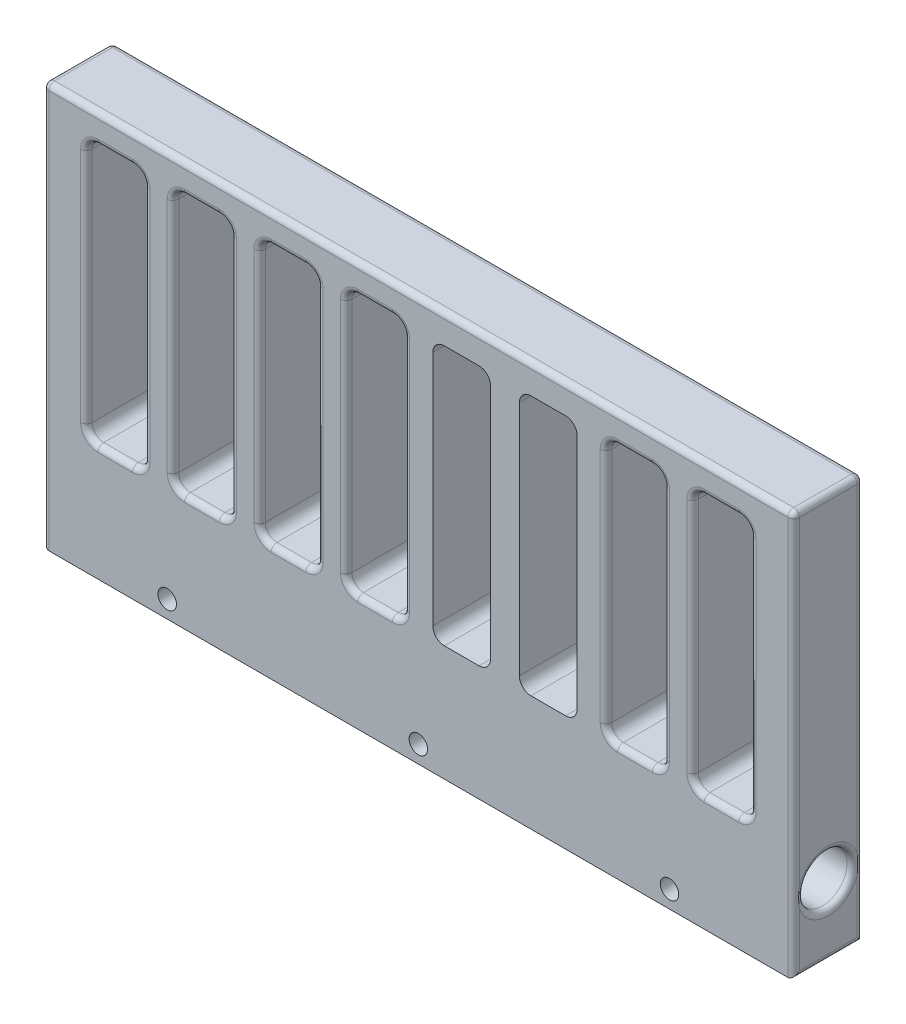
from build123d import *

# Parameters (mm, degrees)
ESQUISSE1_W             = 130
ESQUISSE1_H             = 70
BOSS_EXTRU_1_DEPTH      = 12
ESQUISSE2_W             = 10
ESQUISSE2_H             = 45
ENL_V_MAT_EXTRU_2_DEPTH = 12
ESQUISSE3_R             = 4.25
ENL_V_MAT_EXTRU_3_DEPTH = 154
ESQUISSE4_R             = 1.6
ENL_V_MAT_EXTRU_4_DEPTH = 16
ENL_V_MAT_EXTRU_5_DEPTH = 3
CONG_1_R                = 2
CONG_2_R                = 1


with BuildPart() as part:
    # Esquisse1 → Boss.-Extru.1 (new body)
    with BuildSketch(Plane.XY):
        with Locations((65, 35)):
            Rectangle(ESQUISSE1_W, ESQUISSE1_H)
    extrude(amount=BOSS_EXTRU_1_DEPTH)

    # Esquisse2 → Enlèv. mat.-Extru.2 (cut)
    with BuildSketch(Plane.XY.offset(12)):
        with Locations((12.5, 42.5)):
            Rectangle(ESQUISSE2_W, ESQUISSE2_H)
        with Locations((27.5, 42.5)):
            Rectangle(ESQUISSE2_W, ESQUISSE2_H)
        with Locations((42.5, 42.5)):
            Rectangle(ESQUISSE2_W, ESQUISSE2_H)
        with Locations((57.5, 42.5)):
            Rectangle(ESQUISSE2_W, ESQUISSE2_H)
        with Locations((72.5, 42.5)):
            Rectangle(ESQUISSE2_W, ESQUISSE2_H)
        with Locations((87.5, 42.5)):
            Rectangle(ESQUISSE2_W, ESQUISSE2_H)
        with Locations((102.5, 42.5)):
            Rectangle(ESQUISSE2_W, ESQUISSE2_H)
        with Locations((117.5, 42.5)):
            Rectangle(ESQUISSE2_W, ESQUISSE2_H)
    extrude(amount=-ENL_V_MAT_EXTRU_2_DEPTH, mode=Mode.SUBTRACT)

    # Esquisse3 → Enlèv. mat.-Extru.3 (cut)
    with BuildSketch(Plane.ZY):
        with Locations((6, 12)):
            Circle(ESQUISSE3_R)
    extrude(amount=-ENL_V_MAT_EXTRU_3_DEPTH, mode=Mode.SUBTRACT)

    # Esquisse4 → Enlèv. mat.-Extru.4 (cut)
    with BuildSketch(Plane.XY.offset(12)):
        with Locations((21.5, 3)):
            Circle(ESQUISSE4_R)
        with Locations((65, 3)):
            Circle(ESQUISSE4_R)
        with Locations((108.5, 3)):
            Circle(ESQUISSE4_R)
    extrude(amount=-ENL_V_MAT_EXTRU_4_DEPTH, mode=Mode.SUBTRACT)

    # Esquisse6 → Enlèv. mat.-Extru.5 (cut)
    with BuildSketch(Plane(origin=(0, 0, 0), x_dir=(-1, 0, 0), z_dir=(0, 0, -1))):
        Polygon((-20.163436833, 5.623661354), (-23.1038758, 5.469328333), (-24.440438967, 2.845666979), (-22.836563167, 0.376338646), (-19.8961242, 0.530671667), (-18.559561033, 3.154333021), align=None)
        Polygon((-62.462780767, 4.494161491), (-65.025372192, 5.944377057), (-67.562591426, 4.450215565), (-67.537219233, 1.505838509), (-64.974627808, 0.055622943), (-62.437408574, 1.549784435), align=None)
        Polygon((-106.006326077, 4.565755525), (-108.609147099, 5.942462729), (-111.102821022, 4.376707204), (-110.993673923, 1.434244475), (-108.390852901, 0.057537271), (-105.897178978, 1.623292796), align=None)
    extrude(amount=-ENL_V_MAT_EXTRU_5_DEPTH, mode=Mode.SUBTRACT)

    # Congé1
    cong_1_edges = [part.edges().sort_by_distance(p)[0] for p in [
        (7.5, 20, 6),
        (7.5, 65, 6),
        (17.5, 65, 6),
        (17.5, 20, 6),
        (32.5, 20, 6),
        (22.5, 20, 6),
        (22.5, 65, 6),
        (32.5, 65, 6),
        (47.5, 20, 6),
        (37.5, 20, 6),
        (37.5, 65, 6),
        (47.5, 65, 6),
        (62.5, 20, 6),
        (52.5, 20, 6),
        (52.5, 65, 6),
        (62.5, 65, 6),
        (77.5, 20, 6),
        (67.5, 20, 6),
        (67.5, 65, 6),
        (77.5, 65, 6),
        (92.5, 20, 6),
        (82.5, 20, 6),
        (82.5, 65, 6),
        (92.5, 65, 6),
        (107.5, 20, 6),
        (97.5, 20, 6),
        (97.5, 65, 6),
        (107.5, 65, 6),
        (122.5, 20, 6),
        (112.5, 20, 6),
        (112.5, 65, 6),
        (122.5, 65, 6),
    ]]
    fillet(cong_1_edges, radius=CONG_1_R)

    # Congé2
    # the kernel refuses this fillet: 1 mm, written as the material it takes off along each edge
    with BuildSketch(Plane(origin=(129, 69, 11), x_dir=(0, 1, 0), z_dir=(1, 0, 0))) as cong_2_piece_1_section:
        Polygon((0, 0), (CONG_2_R, 0), (CONG_2_R, CONG_2_R), (0, CONG_2_R), align=None)
    cong_2_piece_1 = extrude(amount=CONG_2_R, mode=Mode.PRIVATE)
    cong_2_piece_1 = cong_2_piece_1 - Plane(origin=(129, 69, 11), x_dir=(0, -0.7071067811865475, -0.7071067811865475), z_dir=(1, 0, 0)) * Sphere(CONG_2_R, mode=Mode.PRIVATE)
    add(cong_2_piece_1, mode=Mode.SUBTRACT)
    with BuildSketch(Plane(origin=(1, 69, 11), x_dir=(0, 1, 0), z_dir=(-1, 0, 0))) as cong_2_piece_2_section:
        Polygon((0, 0), (CONG_2_R, 0), (CONG_2_R, -CONG_2_R), (0, -CONG_2_R), align=None)
    cong_2_piece_2 = extrude(amount=CONG_2_R, mode=Mode.PRIVATE)
    cong_2_piece_2 = cong_2_piece_2 - Plane(origin=(1, 69, 11), x_dir=(0, -0.7071067811865475, -0.7071067811865475), z_dir=(-1, 0, 0)) * Sphere(CONG_2_R, mode=Mode.PRIVATE)
    add(cong_2_piece_2, mode=Mode.SUBTRACT)
    with BuildSketch(Plane(origin=(129, 69, 1), x_dir=(1, 0, 0), z_dir=(0, 0, -1))) as cong_2_piece_3_section:
        Polygon((0, 0), (CONG_2_R, 0), (CONG_2_R, -CONG_2_R), (0, -CONG_2_R), align=None)
    cong_2_piece_3 = extrude(amount=CONG_2_R, mode=Mode.PRIVATE)
    cong_2_piece_3 = cong_2_piece_3 - Plane(origin=(129, 69, 1), x_dir=(-0.7071067811865475, -0.7071067811865475, 0), z_dir=(0, 0, -1)) * Sphere(CONG_2_R, mode=Mode.PRIVATE)
    add(cong_2_piece_3, mode=Mode.SUBTRACT)
    with BuildSketch(Plane(origin=(1, 69, 1), x_dir=(-1, 0, 0), z_dir=(0, 0, -1))) as cong_2_piece_4_section:
        Polygon((0, 0), (CONG_2_R, 0), (CONG_2_R, CONG_2_R), (0, CONG_2_R), align=None)
    cong_2_piece_4 = extrude(amount=CONG_2_R, mode=Mode.PRIVATE)
    cong_2_piece_4 = cong_2_piece_4 - Plane(origin=(1, 69, 1), x_dir=(0.7071067811865475, -0.7071067811865475, 0), z_dir=(0, 0, -1)) * Sphere(CONG_2_R, mode=Mode.PRIVATE)
    add(cong_2_piece_4, mode=Mode.SUBTRACT)
    with BuildSketch(Plane(origin=(130, -2.5, 12), x_dir=(0, 0, -1), z_dir=(0, 1, 0)), Plane(origin=(0, 69, 12), x_dir=(0, 0, -1), z_dir=(0, -1, 0)), Plane(origin=(130, -2.5, 0), x_dir=(-1, 0, 0), z_dir=(0, 1, 0)), Plane(origin=(0, 69, 0), x_dir=(1, 0, 0), z_dir=(0, -1, 0))) as cong_2_piece_5:
        with BuildLine():
            CenterArc((CONG_2_R, CONG_2_R), CONG_2_R, 180, 90)
            Line((0, CONG_2_R), (0, 0))
            Line((0, 0), (CONG_2_R, 0))
        make_face()
    extrude(amount=71.5, mode=Mode.SUBTRACT)
    with BuildSketch(Plane(origin=(129, 70, 12), x_dir=(0, 0, -1), z_dir=(-1, 0, 0)), Plane(origin=(129, 70, 0), x_dir=(0, -1, 0), z_dir=(-1, 0, 0))) as cong_2_piece_6:
        with BuildLine():
            CenterArc((CONG_2_R, CONG_2_R), CONG_2_R, 180, 90)
            Line((0, CONG_2_R), (0, 0))
            Line((0, 0), (CONG_2_R, 0))
        make_face()
    extrude(amount=128, mode=Mode.SUBTRACT)
    with BuildSketch(Plane(origin=(130, 12, 6), x_dir=(0, 0, 1), z_dir=(0, -1, 0))) as cong_2_piece_7:
        with BuildLine():
            CenterArc((4.25 + CONG_2_R, CONG_2_R), CONG_2_R, 180, 90)
            Line((4.25, CONG_2_R), (4.25, 0))
            Line((4.25, 0), (4.25 + CONG_2_R, 0))
        make_face()
    revolve(axis=Axis((130, 12, 6), (-1, 0, 0)), mode=Mode.SUBTRACT)
    with BuildSketch(Plane(origin=(0, 12, 6), x_dir=(0, 0, 1), z_dir=(0, -1, 0))) as cong_2_piece_8:
        with BuildLine():
            CenterArc((4.25 + CONG_2_R, -CONG_2_R), CONG_2_R, 90, 90)
            Line((4.25, -CONG_2_R), (4.25, 0))
            Line((4.25, 0), (4.25 + CONG_2_R, 0))
        make_face()
    revolve(axis=Axis((0, 12, 6), (-1, 0, 0)), mode=Mode.SUBTRACT)
    with BuildSketch(Plane(origin=(75.5, 20, 0), x_dir=(0, -1, 0), z_dir=(-1, 0, 0)), Plane(origin=(60.5, 20, 12), x_dir=(0, 0, -1), z_dir=(-1, 0, 0)), Plane(origin=(60.5, 20, 0), x_dir=(0, -1, 0), z_dir=(-1, 0, 0)), Plane(origin=(45.5, 20, 12), x_dir=(0, 0, -1), z_dir=(-1, 0, 0)), Plane(origin=(45.5, 20, 0), x_dir=(0, -1, 0), z_dir=(-1, 0, 0)), Plane(origin=(30.5, 20, 12), x_dir=(0, 0, -1), z_dir=(-1, 0, 0)), Plane(origin=(30.5, 20, 0), x_dir=(0, -1, 0), z_dir=(-1, 0, 0)), Plane(origin=(105.5, 20, 12), x_dir=(0, 0, -1), z_dir=(-1, 0, 0)), Plane(origin=(105.5, 20, 0), x_dir=(0, -1, 0), z_dir=(-1, 0, 0)), Plane(origin=(24.5, 65, 12), x_dir=(0, 0, -1), z_dir=(1, 0, 0)), Plane(origin=(24.5, 65, 0), x_dir=(0, 1, 0), z_dir=(1, 0, 0)), Plane(origin=(39.5, 65, 12), x_dir=(0, 0, -1), z_dir=(1, 0, 0)), Plane(origin=(39.5, 65, 0), x_dir=(0, 1, 0), z_dir=(1, 0, 0)), Plane(origin=(54.5, 65, 12), x_dir=(0, 0, -1), z_dir=(1, 0, 0)), Plane(origin=(54.5, 65, 0), x_dir=(0, 1, 0), z_dir=(1, 0, 0)), Plane(origin=(69.5, 65, 0), x_dir=(0, 1, 0), z_dir=(1, 0, 0)), Plane(origin=(99.5, 65, 12), x_dir=(0, 0, -1), z_dir=(1, 0, 0)), Plane(origin=(99.5, 65, 0), x_dir=(0, 1, 0), z_dir=(1, 0, 0)), Plane(origin=(114.5, 65, 12), x_dir=(0, 0, -1), z_dir=(1, 0, 0)), Plane(origin=(114.5, 65, 0), x_dir=(0, 1, 0), z_dir=(1, 0, 0)), Plane(origin=(120.5, 20, 12), x_dir=(0, 0, -1), z_dir=(-1, 0, 0)), Plane(origin=(120.5, 20, 0), x_dir=(0, -1, 0), z_dir=(-1, 0, 0))) as cong_2_piece_9:
        with BuildLine():
            CenterArc((CONG_2_R, CONG_2_R), CONG_2_R, 180, 90)
            Line((0, CONG_2_R), (0, 0))
            Line((0, 0), (CONG_2_R, 0))
        make_face()
    extrude(amount=6, mode=Mode.SUBTRACT)
    with BuildSketch(Plane(origin=(67.5, 22, 0), x_dir=(-1, 0, 0), z_dir=(0, 1, 0)), Plane(origin=(52.5, 22, 12), x_dir=(0, 0, -1), z_dir=(0, 1, 0)), Plane(origin=(52.5, 22, 0), x_dir=(-1, 0, 0), z_dir=(0, 1, 0)), Plane(origin=(37.5, 22, 12), x_dir=(0, 0, -1), z_dir=(0, 1, 0)), Plane(origin=(37.5, 22, 0), x_dir=(-1, 0, 0), z_dir=(0, 1, 0)), Plane(origin=(22.5, 22, 12), x_dir=(0, 0, -1), z_dir=(0, 1, 0)), Plane(origin=(22.5, 22, 0), x_dir=(-1, 0, 0), z_dir=(0, 1, 0)), Plane(origin=(97.5, 22, 12), x_dir=(0, 0, -1), z_dir=(0, 1, 0)), Plane(origin=(97.5, 22, 0), x_dir=(-1, 0, 0), z_dir=(0, 1, 0)), Plane(origin=(112.5, 22, 12), x_dir=(0, 0, -1), z_dir=(0, 1, 0)), Plane(origin=(112.5, 22, 0), x_dir=(-1, 0, 0), z_dir=(0, 1, 0)), Plane(origin=(122.5, 63, 12), x_dir=(0, 0, -1), z_dir=(0, -1, 0)), Plane(origin=(122.5, 63, 0), x_dir=(1, 0, 0), z_dir=(0, -1, 0)), Plane(origin=(107.5, 63, 12), x_dir=(0, 0, -1), z_dir=(0, -1, 0)), Plane(origin=(107.5, 63, 0), x_dir=(1, 0, 0), z_dir=(0, -1, 0)), Plane(origin=(77.5, 63, 0), x_dir=(1, 0, 0), z_dir=(0, -1, 0)), Plane(origin=(62.5, 63, 12), x_dir=(0, 0, -1), z_dir=(0, -1, 0)), Plane(origin=(62.5, 63, 0), x_dir=(1, 0, 0), z_dir=(0, -1, 0)), Plane(origin=(47.5, 63, 12), x_dir=(0, 0, -1), z_dir=(0, -1, 0)), Plane(origin=(47.5, 63, 0), x_dir=(1, 0, 0), z_dir=(0, -1, 0)), Plane(origin=(32.5, 63, 12), x_dir=(0, 0, -1), z_dir=(0, -1, 0)), Plane(origin=(32.5, 63, 0), x_dir=(1, 0, 0), z_dir=(0, -1, 0))) as cong_2_piece_10:
        with BuildLine():
            CenterArc((CONG_2_R, CONG_2_R), CONG_2_R, 180, 90)
            Line((0, CONG_2_R), (0, 0))
            Line((0, 0), (CONG_2_R, 0))
        make_face()
    extrude(amount=41, mode=Mode.SUBTRACT)
    with BuildSketch(Plane(origin=(9.5, 20, 12), x_dir=(0, 0, -1), z_dir=(1, 0, 0)), Plane(origin=(9.5, 20, 0), x_dir=(0, -1, 0), z_dir=(1, 0, 0)), Plane(origin=(15.5, 65, 12), x_dir=(0, 0, -1), z_dir=(-1, 0, 0)), Plane(origin=(15.5, 65, 0), x_dir=(0, 1, 0), z_dir=(-1, 0, 0))) as cong_2_piece_11:
        with BuildLine():
            CenterArc((CONG_2_R, -CONG_2_R), CONG_2_R, 90, 90)
            Line((0, -CONG_2_R), (0, 0))
            Line((0, 0), (CONG_2_R, 0))
        make_face()
    extrude(amount=6, mode=Mode.SUBTRACT)
    with BuildSketch(Plane(origin=(7.5, 63, 12), x_dir=(0, 0, -1), z_dir=(0, -1, 0)), Plane(origin=(7.5, 63, 0), x_dir=(-1, 0, 0), z_dir=(0, -1, 0)), Plane(origin=(17.5, 22, 12), x_dir=(0, 0, -1), z_dir=(0, 1, 0)), Plane(origin=(17.5, 22, 0), x_dir=(1, 0, 0), z_dir=(0, 1, 0))) as cong_2_piece_12:
        with BuildLine():
            CenterArc((CONG_2_R, -CONG_2_R), CONG_2_R, 90, 90)
            Line((0, -CONG_2_R), (0, 0))
            Line((0, 0), (CONG_2_R, 0))
        make_face()
    extrude(amount=41, mode=Mode.SUBTRACT)
    with BuildSketch(Plane(origin=(69.5, 22, 0), x_dir=(0, -1, 0), z_dir=(1, 0, 0))) as cong_2_piece_13:
        with BuildLine():
            CenterArc((2 + CONG_2_R, -CONG_2_R), CONG_2_R, 90, 90)
            Line((2, -CONG_2_R), (2, 0))
            Line((2, 0), (2 + CONG_2_R, 0))
        make_face()
    revolve(axis=Axis((69.5, 22, 0), (0, 0, -1)), revolution_arc=90, mode=Mode.SUBTRACT)
    with BuildSketch(Plane(origin=(54.5, 22, 12), x_dir=(0, -1, 0), z_dir=(1, 0, 0))) as cong_2_piece_14:
        with BuildLine():
            CenterArc((2 + CONG_2_R, CONG_2_R), CONG_2_R, 180, 90)
            Line((2 + CONG_2_R, 0), (2, 0))
            Line((2, 0), (2, CONG_2_R))
        make_face()
    revolve(axis=Axis((54.5, 22, 12), (0, 0, -1)), revolution_arc=90, mode=Mode.SUBTRACT)
    with BuildSketch(Plane(origin=(54.5, 22, 0), x_dir=(0, -1, 0), z_dir=(1, 0, 0))) as cong_2_piece_15:
        with BuildLine():
            CenterArc((2 + CONG_2_R, -CONG_2_R), CONG_2_R, 90, 90)
            Line((2, -CONG_2_R), (2, 0))
            Line((2, 0), (2 + CONG_2_R, 0))
        make_face()
    revolve(axis=Axis((54.5, 22, 0), (0, 0, -1)), revolution_arc=90, mode=Mode.SUBTRACT)
    with BuildSketch(Plane(origin=(39.5, 22, 12), x_dir=(0, -1, 0), z_dir=(1, 0, 0))) as cong_2_piece_16:
        with BuildLine():
            CenterArc((2 + CONG_2_R, CONG_2_R), CONG_2_R, 180, 90)
            Line((2 + CONG_2_R, 0), (2, 0))
            Line((2, 0), (2, CONG_2_R))
        make_face()
    revolve(axis=Axis((39.5, 22, 12), (0, 0, -1)), revolution_arc=90, mode=Mode.SUBTRACT)
    with BuildSketch(Plane(origin=(39.5, 22, 0), x_dir=(0, -1, 0), z_dir=(1, 0, 0))) as cong_2_piece_17:
        with BuildLine():
            CenterArc((2 + CONG_2_R, -CONG_2_R), CONG_2_R, 90, 90)
            Line((2, -CONG_2_R), (2, 0))
            Line((2, 0), (2 + CONG_2_R, 0))
        make_face()
    revolve(axis=Axis((39.5, 22, 0), (0, 0, -1)), revolution_arc=90, mode=Mode.SUBTRACT)
    with BuildSketch(Plane(origin=(24.5, 22, 12), x_dir=(0, -1, 0), z_dir=(1, 0, 0))) as cong_2_piece_18:
        with BuildLine():
            CenterArc((2 + CONG_2_R, CONG_2_R), CONG_2_R, 180, 90)
            Line((2 + CONG_2_R, 0), (2, 0))
            Line((2, 0), (2, CONG_2_R))
        make_face()
    revolve(axis=Axis((24.5, 22, 12), (0, 0, -1)), revolution_arc=90, mode=Mode.SUBTRACT)
    with BuildSketch(Plane(origin=(24.5, 22, 0), x_dir=(0, -1, 0), z_dir=(1, 0, 0))) as cong_2_piece_19:
        with BuildLine():
            CenterArc((2 + CONG_2_R, -CONG_2_R), CONG_2_R, 90, 90)
            Line((2, -CONG_2_R), (2, 0))
            Line((2, 0), (2 + CONG_2_R, 0))
        make_face()
    revolve(axis=Axis((24.5, 22, 0), (0, 0, -1)), revolution_arc=90, mode=Mode.SUBTRACT)
    with BuildSketch(Plane(origin=(9.5, 22, 12), x_dir=(0, -1, 0), z_dir=(1, 0, 0))) as cong_2_piece_20:
        with BuildLine():
            CenterArc((2 + CONG_2_R, CONG_2_R), CONG_2_R, 180, 90)
            Line((2 + CONG_2_R, 0), (2, 0))
            Line((2, 0), (2, CONG_2_R))
        make_face()
    revolve(axis=Axis((9.5, 22, 12), (0, 0, -1)), revolution_arc=90, mode=Mode.SUBTRACT)
    with BuildSketch(Plane(origin=(9.5, 22, 0), x_dir=(0, -1, 0), z_dir=(1, 0, 0))) as cong_2_piece_21:
        with BuildLine():
            CenterArc((2 + CONG_2_R, -CONG_2_R), CONG_2_R, 90, 90)
            Line((2, -CONG_2_R), (2, 0))
            Line((2, 0), (2 + CONG_2_R, 0))
        make_face()
    revolve(axis=Axis((9.5, 22, 0), (0, 0, -1)), revolution_arc=90, mode=Mode.SUBTRACT)
    with BuildSketch(Plane(origin=(99.5, 22, 12), x_dir=(0, -1, 0), z_dir=(1, 0, 0))) as cong_2_piece_22:
        with BuildLine():
            CenterArc((2 + CONG_2_R, CONG_2_R), CONG_2_R, 180, 90)
            Line((2 + CONG_2_R, 0), (2, 0))
            Line((2, 0), (2, CONG_2_R))
        make_face()
    revolve(axis=Axis((99.5, 22, 12), (0, 0, -1)), revolution_arc=90, mode=Mode.SUBTRACT)
    with BuildSketch(Plane(origin=(99.5, 22, 0), x_dir=(0, -1, 0), z_dir=(1, 0, 0))) as cong_2_piece_23:
        with BuildLine():
            CenterArc((2 + CONG_2_R, -CONG_2_R), CONG_2_R, 90, 90)
            Line((2, -CONG_2_R), (2, 0))
            Line((2, 0), (2 + CONG_2_R, 0))
        make_face()
    revolve(axis=Axis((99.5, 22, 0), (0, 0, -1)), revolution_arc=90, mode=Mode.SUBTRACT)
    with BuildSketch(Plane(origin=(9.5, 63, 12), x_dir=(-1, 0, 0), z_dir=(0, -1, 0))) as cong_2_piece_24:
        with BuildLine():
            CenterArc((2 + CONG_2_R, CONG_2_R), CONG_2_R, 180, 90)
            Line((2 + CONG_2_R, 0), (2, 0))
            Line((2, 0), (2, CONG_2_R))
        make_face()
    revolve(axis=Axis((9.5, 63, 12), (0, 0, -1)), revolution_arc=90, mode=Mode.SUBTRACT)
    with BuildSketch(Plane(origin=(9.5, 63, 0), x_dir=(-1, 0, 0), z_dir=(0, -1, 0))) as cong_2_piece_25:
        with BuildLine():
            CenterArc((2 + CONG_2_R, -CONG_2_R), CONG_2_R, 90, 90)
            Line((2, -CONG_2_R), (2, 0))
            Line((2, 0), (2 + CONG_2_R, 0))
        make_face()
    revolve(axis=Axis((9.5, 63, 0), (0, 0, -1)), revolution_arc=90, mode=Mode.SUBTRACT)
    with BuildSketch(Plane(origin=(24.5, 63, 12), x_dir=(-1, 0, 0), z_dir=(0, -1, 0))) as cong_2_piece_26:
        with BuildLine():
            CenterArc((2 + CONG_2_R, CONG_2_R), CONG_2_R, 180, 90)
            Line((2 + CONG_2_R, 0), (2, 0))
            Line((2, 0), (2, CONG_2_R))
        make_face()
    revolve(axis=Axis((24.5, 63, 12), (0, 0, -1)), revolution_arc=90, mode=Mode.SUBTRACT)
    with BuildSketch(Plane(origin=(24.5, 63, 0), x_dir=(-1, 0, 0), z_dir=(0, -1, 0))) as cong_2_piece_27:
        with BuildLine():
            CenterArc((2 + CONG_2_R, -CONG_2_R), CONG_2_R, 90, 90)
            Line((2, -CONG_2_R), (2, 0))
            Line((2, 0), (2 + CONG_2_R, 0))
        make_face()
    revolve(axis=Axis((24.5, 63, 0), (0, 0, -1)), revolution_arc=90, mode=Mode.SUBTRACT)
    with BuildSketch(Plane(origin=(39.5, 63, 12), x_dir=(-1, 0, 0), z_dir=(0, -1, 0))) as cong_2_piece_28:
        with BuildLine():
            CenterArc((2 + CONG_2_R, CONG_2_R), CONG_2_R, 180, 90)
            Line((2 + CONG_2_R, 0), (2, 0))
            Line((2, 0), (2, CONG_2_R))
        make_face()
    revolve(axis=Axis((39.5, 63, 12), (0, 0, -1)), revolution_arc=90, mode=Mode.SUBTRACT)
    with BuildSketch(Plane(origin=(39.5, 63, 0), x_dir=(-1, 0, 0), z_dir=(0, -1, 0))) as cong_2_piece_29:
        with BuildLine():
            CenterArc((2 + CONG_2_R, -CONG_2_R), CONG_2_R, 90, 90)
            Line((2, -CONG_2_R), (2, 0))
            Line((2, 0), (2 + CONG_2_R, 0))
        make_face()
    revolve(axis=Axis((39.5, 63, 0), (0, 0, -1)), revolution_arc=90, mode=Mode.SUBTRACT)
    with BuildSketch(Plane(origin=(54.5, 63, 12), x_dir=(-1, 0, 0), z_dir=(0, -1, 0))) as cong_2_piece_30:
        with BuildLine():
            CenterArc((2 + CONG_2_R, CONG_2_R), CONG_2_R, 180, 90)
            Line((2 + CONG_2_R, 0), (2, 0))
            Line((2, 0), (2, CONG_2_R))
        make_face()
    revolve(axis=Axis((54.5, 63, 12), (0, 0, -1)), revolution_arc=90, mode=Mode.SUBTRACT)
    with BuildSketch(Plane(origin=(54.5, 63, 0), x_dir=(-1, 0, 0), z_dir=(0, -1, 0))) as cong_2_piece_31:
        with BuildLine():
            CenterArc((2 + CONG_2_R, -CONG_2_R), CONG_2_R, 90, 90)
            Line((2, -CONG_2_R), (2, 0))
            Line((2, 0), (2 + CONG_2_R, 0))
        make_face()
    revolve(axis=Axis((54.5, 63, 0), (0, 0, -1)), revolution_arc=90, mode=Mode.SUBTRACT)
    with BuildSketch(Plane(origin=(69.5, 63, 0), x_dir=(-1, 0, 0), z_dir=(0, -1, 0))) as cong_2_piece_32:
        with BuildLine():
            CenterArc((2 + CONG_2_R, -CONG_2_R), CONG_2_R, 90, 90)
            Line((2, -CONG_2_R), (2, 0))
            Line((2, 0), (2 + CONG_2_R, 0))
        make_face()
    revolve(axis=Axis((69.5, 63, 0), (0, 0, -1)), revolution_arc=90, mode=Mode.SUBTRACT)
    with BuildSketch(Plane(origin=(99.5, 63, 12), x_dir=(-1, 0, 0), z_dir=(0, -1, 0))) as cong_2_piece_33:
        with BuildLine():
            CenterArc((2 + CONG_2_R, CONG_2_R), CONG_2_R, 180, 90)
            Line((2 + CONG_2_R, 0), (2, 0))
            Line((2, 0), (2, CONG_2_R))
        make_face()
    revolve(axis=Axis((99.5, 63, 12), (0, 0, -1)), revolution_arc=90, mode=Mode.SUBTRACT)
    with BuildSketch(Plane(origin=(99.5, 63, 0), x_dir=(-1, 0, 0), z_dir=(0, -1, 0))) as cong_2_piece_34:
        with BuildLine():
            CenterArc((2 + CONG_2_R, -CONG_2_R), CONG_2_R, 90, 90)
            Line((2, -CONG_2_R), (2, 0))
            Line((2, 0), (2 + CONG_2_R, 0))
        make_face()
    revolve(axis=Axis((99.5, 63, 0), (0, 0, -1)), revolution_arc=90, mode=Mode.SUBTRACT)
    with BuildSketch(Plane(origin=(114.5, 63, 12), x_dir=(-1, 0, 0), z_dir=(0, -1, 0))) as cong_2_piece_35:
        with BuildLine():
            CenterArc((2 + CONG_2_R, CONG_2_R), CONG_2_R, 180, 90)
            Line((2 + CONG_2_R, 0), (2, 0))
            Line((2, 0), (2, CONG_2_R))
        make_face()
    revolve(axis=Axis((114.5, 63, 12), (0, 0, -1)), revolution_arc=90, mode=Mode.SUBTRACT)
    with BuildSketch(Plane(origin=(114.5, 63, 0), x_dir=(-1, 0, 0), z_dir=(0, -1, 0))) as cong_2_piece_36:
        with BuildLine():
            CenterArc((2 + CONG_2_R, -CONG_2_R), CONG_2_R, 90, 90)
            Line((2, -CONG_2_R), (2, 0))
            Line((2, 0), (2 + CONG_2_R, 0))
        make_face()
    revolve(axis=Axis((114.5, 63, 0), (0, 0, -1)), revolution_arc=90, mode=Mode.SUBTRACT)
    with BuildSketch(Plane(origin=(120.5, 63, 12), x_dir=(1, 0, 0), z_dir=(0, -1, 0))) as cong_2_piece_37:
        with BuildLine():
            CenterArc((2 + CONG_2_R, -CONG_2_R), CONG_2_R, 90, 90)
            Line((2 + CONG_2_R, 0), (2, 0))
            Line((2, 0), (2, -CONG_2_R))
        make_face()
    revolve(axis=Axis((120.5, 63, 12), (0, 0, 1)), revolution_arc=90, mode=Mode.SUBTRACT)
    with BuildSketch(Plane(origin=(120.5, 63, 0), x_dir=(1, 0, 0), z_dir=(0, -1, 0))) as cong_2_piece_38:
        with BuildLine():
            CenterArc((2 + CONG_2_R, CONG_2_R), CONG_2_R, 180, 90)
            Line((2, CONG_2_R), (2, 0))
            Line((2, 0), (2 + CONG_2_R, 0))
        make_face()
    revolve(axis=Axis((120.5, 63, 0), (0, 0, 1)), revolution_arc=90, mode=Mode.SUBTRACT)
    with BuildSketch(Plane(origin=(105.5, 63, 12), x_dir=(1, 0, 0), z_dir=(0, -1, 0))) as cong_2_piece_39:
        with BuildLine():
            CenterArc((2 + CONG_2_R, -CONG_2_R), CONG_2_R, 90, 90)
            Line((2 + CONG_2_R, 0), (2, 0))
            Line((2, 0), (2, -CONG_2_R))
        make_face()
    revolve(axis=Axis((105.5, 63, 12), (0, 0, 1)), revolution_arc=90, mode=Mode.SUBTRACT)
    with BuildSketch(Plane(origin=(105.5, 63, 0), x_dir=(1, 0, 0), z_dir=(0, -1, 0))) as cong_2_piece_40:
        with BuildLine():
            CenterArc((2 + CONG_2_R, CONG_2_R), CONG_2_R, 180, 90)
            Line((2, CONG_2_R), (2, 0))
            Line((2, 0), (2 + CONG_2_R, 0))
        make_face()
    revolve(axis=Axis((105.5, 63, 0), (0, 0, 1)), revolution_arc=90, mode=Mode.SUBTRACT)
    with BuildSketch(Plane(origin=(75.5, 63, 0), x_dir=(1, 0, 0), z_dir=(0, -1, 0))) as cong_2_piece_41:
        with BuildLine():
            CenterArc((2 + CONG_2_R, CONG_2_R), CONG_2_R, 180, 90)
            Line((2, CONG_2_R), (2, 0))
            Line((2, 0), (2 + CONG_2_R, 0))
        make_face()
    revolve(axis=Axis((75.5, 63, 0), (0, 0, 1)), revolution_arc=90, mode=Mode.SUBTRACT)
    with BuildSketch(Plane(origin=(60.5, 63, 12), x_dir=(1, 0, 0), z_dir=(0, -1, 0))) as cong_2_piece_42:
        with BuildLine():
            CenterArc((2 + CONG_2_R, -CONG_2_R), CONG_2_R, 90, 90)
            Line((2 + CONG_2_R, 0), (2, 0))
            Line((2, 0), (2, -CONG_2_R))
        make_face()
    revolve(axis=Axis((60.5, 63, 12), (0, 0, 1)), revolution_arc=90, mode=Mode.SUBTRACT)
    with BuildSketch(Plane(origin=(60.5, 63, 0), x_dir=(1, 0, 0), z_dir=(0, -1, 0))) as cong_2_piece_43:
        with BuildLine():
            CenterArc((2 + CONG_2_R, CONG_2_R), CONG_2_R, 180, 90)
            Line((2, CONG_2_R), (2, 0))
            Line((2, 0), (2 + CONG_2_R, 0))
        make_face()
    revolve(axis=Axis((60.5, 63, 0), (0, 0, 1)), revolution_arc=90, mode=Mode.SUBTRACT)
    with BuildSketch(Plane(origin=(45.5, 63, 12), x_dir=(1, 0, 0), z_dir=(0, -1, 0))) as cong_2_piece_44:
        with BuildLine():
            CenterArc((2 + CONG_2_R, -CONG_2_R), CONG_2_R, 90, 90)
            Line((2 + CONG_2_R, 0), (2, 0))
            Line((2, 0), (2, -CONG_2_R))
        make_face()
    revolve(axis=Axis((45.5, 63, 12), (0, 0, 1)), revolution_arc=90, mode=Mode.SUBTRACT)
    with BuildSketch(Plane(origin=(45.5, 63, 0), x_dir=(1, 0, 0), z_dir=(0, -1, 0))) as cong_2_piece_45:
        with BuildLine():
            CenterArc((2 + CONG_2_R, CONG_2_R), CONG_2_R, 180, 90)
            Line((2, CONG_2_R), (2, 0))
            Line((2, 0), (2 + CONG_2_R, 0))
        make_face()
    revolve(axis=Axis((45.5, 63, 0), (0, 0, 1)), revolution_arc=90, mode=Mode.SUBTRACT)
    with BuildSketch(Plane(origin=(30.5, 63, 12), x_dir=(1, 0, 0), z_dir=(0, -1, 0))) as cong_2_piece_46:
        with BuildLine():
            CenterArc((2 + CONG_2_R, -CONG_2_R), CONG_2_R, 90, 90)
            Line((2 + CONG_2_R, 0), (2, 0))
            Line((2, 0), (2, -CONG_2_R))
        make_face()
    revolve(axis=Axis((30.5, 63, 12), (0, 0, 1)), revolution_arc=90, mode=Mode.SUBTRACT)
    with BuildSketch(Plane(origin=(30.5, 63, 0), x_dir=(1, 0, 0), z_dir=(0, -1, 0))) as cong_2_piece_47:
        with BuildLine():
            CenterArc((2 + CONG_2_R, CONG_2_R), CONG_2_R, 180, 90)
            Line((2, CONG_2_R), (2, 0))
            Line((2, 0), (2 + CONG_2_R, 0))
        make_face()
    revolve(axis=Axis((30.5, 63, 0), (0, 0, 1)), revolution_arc=90, mode=Mode.SUBTRACT)
    with BuildSketch(Plane(origin=(15.5, 63, 12), x_dir=(1, 0, 0), z_dir=(0, -1, 0))) as cong_2_piece_48:
        with BuildLine():
            CenterArc((2 + CONG_2_R, -CONG_2_R), CONG_2_R, 90, 90)
            Line((2 + CONG_2_R, 0), (2, 0))
            Line((2, 0), (2, -CONG_2_R))
        make_face()
    revolve(axis=Axis((15.5, 63, 12), (0, 0, 1)), revolution_arc=90, mode=Mode.SUBTRACT)
    with BuildSketch(Plane(origin=(15.5, 63, 0), x_dir=(1, 0, 0), z_dir=(0, -1, 0))) as cong_2_piece_49:
        with BuildLine():
            CenterArc((2 + CONG_2_R, CONG_2_R), CONG_2_R, 180, 90)
            Line((2, CONG_2_R), (2, 0))
            Line((2, 0), (2 + CONG_2_R, 0))
        make_face()
    revolve(axis=Axis((15.5, 63, 0), (0, 0, 1)), revolution_arc=90, mode=Mode.SUBTRACT)
    with BuildSketch(Plane(origin=(15.5, 22, 12), x_dir=(0, -1, 0), z_dir=(-1, 0, 0))) as cong_2_piece_50:
        with BuildLine():
            CenterArc((2 + CONG_2_R, -CONG_2_R), CONG_2_R, 90, 90)
            Line((2 + CONG_2_R, 0), (2, 0))
            Line((2, 0), (2, -CONG_2_R))
        make_face()
    revolve(axis=Axis((15.5, 22, 12), (0, 0, 1)), revolution_arc=90, mode=Mode.SUBTRACT)
    with BuildSketch(Plane(origin=(15.5, 22, 0), x_dir=(0, -1, 0), z_dir=(-1, 0, 0))) as cong_2_piece_51:
        with BuildLine():
            CenterArc((2 + CONG_2_R, CONG_2_R), CONG_2_R, 180, 90)
            Line((2, CONG_2_R), (2, 0))
            Line((2, 0), (2 + CONG_2_R, 0))
        make_face()
    revolve(axis=Axis((15.5, 22, 0), (0, 0, 1)), revolution_arc=90, mode=Mode.SUBTRACT)
    with BuildSketch(Plane(origin=(30.5, 22, 12), x_dir=(0, -1, 0), z_dir=(-1, 0, 0))) as cong_2_piece_52:
        with BuildLine():
            CenterArc((2 + CONG_2_R, -CONG_2_R), CONG_2_R, 90, 90)
            Line((2 + CONG_2_R, 0), (2, 0))
            Line((2, 0), (2, -CONG_2_R))
        make_face()
    revolve(axis=Axis((30.5, 22, 12), (0, 0, 1)), revolution_arc=90, mode=Mode.SUBTRACT)
    with BuildSketch(Plane(origin=(30.5, 22, 0), x_dir=(0, -1, 0), z_dir=(-1, 0, 0))) as cong_2_piece_53:
        with BuildLine():
            CenterArc((2 + CONG_2_R, CONG_2_R), CONG_2_R, 180, 90)
            Line((2, CONG_2_R), (2, 0))
            Line((2, 0), (2 + CONG_2_R, 0))
        make_face()
    revolve(axis=Axis((30.5, 22, 0), (0, 0, 1)), revolution_arc=90, mode=Mode.SUBTRACT)
    with BuildSketch(Plane(origin=(45.5, 22, 12), x_dir=(0, -1, 0), z_dir=(-1, 0, 0))) as cong_2_piece_54:
        with BuildLine():
            CenterArc((2 + CONG_2_R, -CONG_2_R), CONG_2_R, 90, 90)
            Line((2 + CONG_2_R, 0), (2, 0))
            Line((2, 0), (2, -CONG_2_R))
        make_face()
    revolve(axis=Axis((45.5, 22, 12), (0, 0, 1)), revolution_arc=90, mode=Mode.SUBTRACT)
    with BuildSketch(Plane(origin=(45.5, 22, 0), x_dir=(0, -1, 0), z_dir=(-1, 0, 0))) as cong_2_piece_55:
        with BuildLine():
            CenterArc((2 + CONG_2_R, CONG_2_R), CONG_2_R, 180, 90)
            Line((2, CONG_2_R), (2, 0))
            Line((2, 0), (2 + CONG_2_R, 0))
        make_face()
    revolve(axis=Axis((45.5, 22, 0), (0, 0, 1)), revolution_arc=90, mode=Mode.SUBTRACT)
    with BuildSketch(Plane(origin=(60.5, 22, 12), x_dir=(0, -1, 0), z_dir=(-1, 0, 0))) as cong_2_piece_56:
        with BuildLine():
            CenterArc((2 + CONG_2_R, -CONG_2_R), CONG_2_R, 90, 90)
            Line((2 + CONG_2_R, 0), (2, 0))
            Line((2, 0), (2, -CONG_2_R))
        make_face()
    revolve(axis=Axis((60.5, 22, 12), (0, 0, 1)), revolution_arc=90, mode=Mode.SUBTRACT)
    with BuildSketch(Plane(origin=(60.5, 22, 0), x_dir=(0, -1, 0), z_dir=(-1, 0, 0))) as cong_2_piece_57:
        with BuildLine():
            CenterArc((2 + CONG_2_R, CONG_2_R), CONG_2_R, 180, 90)
            Line((2, CONG_2_R), (2, 0))
            Line((2, 0), (2 + CONG_2_R, 0))
        make_face()
    revolve(axis=Axis((60.5, 22, 0), (0, 0, 1)), revolution_arc=90, mode=Mode.SUBTRACT)
    with BuildSketch(Plane(origin=(75.5, 22, 0), x_dir=(0, -1, 0), z_dir=(-1, 0, 0))) as cong_2_piece_58:
        with BuildLine():
            CenterArc((2 + CONG_2_R, CONG_2_R), CONG_2_R, 180, 90)
            Line((2, CONG_2_R), (2, 0))
            Line((2, 0), (2 + CONG_2_R, 0))
        make_face()
    revolve(axis=Axis((75.5, 22, 0), (0, 0, 1)), revolution_arc=90, mode=Mode.SUBTRACT)
    with BuildSketch(Plane(origin=(105.5, 22, 12), x_dir=(0, -1, 0), z_dir=(-1, 0, 0))) as cong_2_piece_59:
        with BuildLine():
            CenterArc((2 + CONG_2_R, -CONG_2_R), CONG_2_R, 90, 90)
            Line((2 + CONG_2_R, 0), (2, 0))
            Line((2, 0), (2, -CONG_2_R))
        make_face()
    revolve(axis=Axis((105.5, 22, 12), (0, 0, 1)), revolution_arc=90, mode=Mode.SUBTRACT)
    with BuildSketch(Plane(origin=(105.5, 22, 0), x_dir=(0, -1, 0), z_dir=(-1, 0, 0))) as cong_2_piece_60:
        with BuildLine():
            CenterArc((2 + CONG_2_R, CONG_2_R), CONG_2_R, 180, 90)
            Line((2, CONG_2_R), (2, 0))
            Line((2, 0), (2 + CONG_2_R, 0))
        make_face()
    revolve(axis=Axis((105.5, 22, 0), (0, 0, 1)), revolution_arc=90, mode=Mode.SUBTRACT)
    with BuildSketch(Plane(origin=(120.5, 22, 12), x_dir=(0, -1, 0), z_dir=(-1, 0, 0))) as cong_2_piece_61:
        with BuildLine():
            CenterArc((2 + CONG_2_R, -CONG_2_R), CONG_2_R, 90, 90)
            Line((2 + CONG_2_R, 0), (2, 0))
            Line((2, 0), (2, -CONG_2_R))
        make_face()
    revolve(axis=Axis((120.5, 22, 12), (0, 0, 1)), revolution_arc=90, mode=Mode.SUBTRACT)
    with BuildSketch(Plane(origin=(120.5, 22, 0), x_dir=(0, -1, 0), z_dir=(-1, 0, 0))) as cong_2_piece_62:
        with BuildLine():
            CenterArc((2 + CONG_2_R, CONG_2_R), CONG_2_R, 180, 90)
            Line((2, CONG_2_R), (2, 0))
            Line((2, 0), (2 + CONG_2_R, 0))
        make_face()
    revolve(axis=Axis((120.5, 22, 0), (0, 0, 1)), revolution_arc=90, mode=Mode.SUBTRACT)
    with BuildSketch(Plane(origin=(114.5, 22, 12), x_dir=(0, -1, 0), z_dir=(1, 0, 0))) as cong_2_piece_63:
        with BuildLine():
            CenterArc((2 + CONG_2_R, CONG_2_R), CONG_2_R, 180, 90)
            Line((2 + CONG_2_R, 0), (2, 0))
            Line((2, 0), (2, CONG_2_R))
        make_face()
    revolve(axis=Axis((114.5, 22, 12), (0, 0, -1)), revolution_arc=90, mode=Mode.SUBTRACT)
    with BuildSketch(Plane(origin=(114.5, 22, 0), x_dir=(0, -1, 0), z_dir=(1, 0, 0))) as cong_2_piece_64:
        with BuildLine():
            CenterArc((2 + CONG_2_R, -CONG_2_R), CONG_2_R, 90, 90)
            Line((2, -CONG_2_R), (2, 0))
            Line((2, 0), (2 + CONG_2_R, 0))
        make_face()
    revolve(axis=Axis((114.5, 22, 0), (0, 0, -1)), revolution_arc=90, mode=Mode.SUBTRACT)
    with BuildSketch(Plane(origin=(0, 70, 1), x_dir=(0, -1, 0), z_dir=(0, 0, 1))) as cong_2_piece_65:
        with BuildLine():
            CenterArc((CONG_2_R, CONG_2_R), CONG_2_R, 180, 90)
            Line((0, CONG_2_R), (0, 0))
            Line((0, 0), (CONG_2_R, 0))
        make_face()
    extrude(amount=10, mode=Mode.SUBTRACT)
    with BuildSketch(Plane(origin=(130, 70, 1), x_dir=(0, -1, 0), z_dir=(0, 0, 1))) as cong_2_piece_66:
        with BuildLine():
            CenterArc((CONG_2_R, -CONG_2_R), CONG_2_R, 90, 90)
            Line((0, -CONG_2_R), (0, 0))
            Line((0, 0), (CONG_2_R, 0))
        make_face()
    extrude(amount=10, mode=Mode.SUBTRACT)
    with BuildSketch(Plane(origin=(130, 0, -2.5), x_dir=(-1, 0, 0), z_dir=(0, 0, 1))) as cong_2_piece_67:
        with BuildLine():
            CenterArc((CONG_2_R, -CONG_2_R), CONG_2_R, 90, 90)
            Line((0, -CONG_2_R), (0, 0))
            Line((0, 0), (CONG_2_R, 0))
        make_face()
    extrude(amount=17, mode=Mode.SUBTRACT)
    with BuildSketch(Plane(origin=(0, 0, -2.5), x_dir=(1, 0, 0), z_dir=(0, 0, 1))) as cong_2_piece_68:
        with BuildLine():
            CenterArc((CONG_2_R, CONG_2_R), CONG_2_R, 180, 90)
            Line((0, CONG_2_R), (0, 0))
            Line((0, 0), (CONG_2_R, 0))
        make_face()
    extrude(amount=17, mode=Mode.SUBTRACT)


solid = part.part
